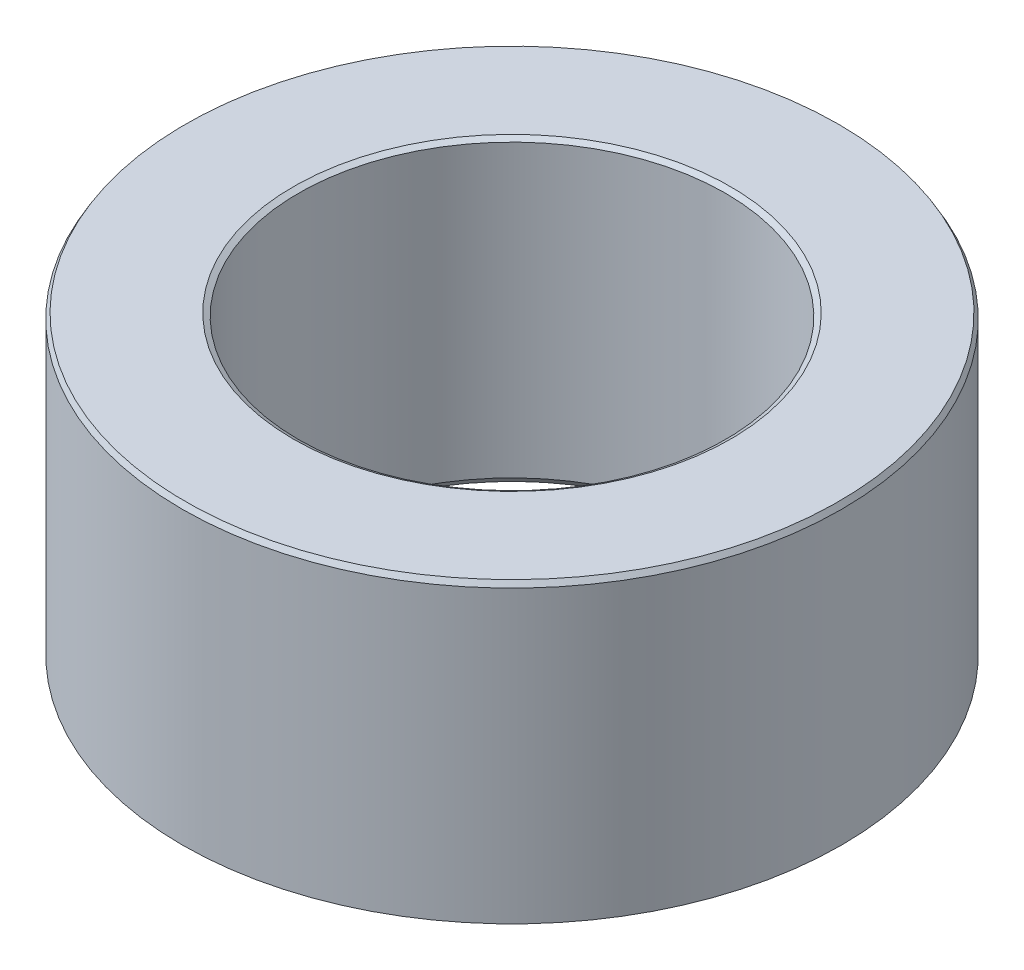
from build123d import *
from OCP.BRepFilletAPI import BRepFilletAPI_MakeChamfer

# Parameters (mm, degrees)
SKETCH1_R           = 45
BOSS_EXTRUDE1_DEPTH = 40.814567303
SKETCH2_R           = 29.131655499
CUT_EXTRUDE1_DEPTH  = 76.603101154
CHAMFER1_SIZE       = 0.712806596
CHAMFER1_SIZE2      = 0.41153908


with BuildPart() as part:
    # Sketch1 → Boss-Extrude1 (new body)
    with BuildSketch(Plane(origin=(0, 0, 0), x_dir=(1, 0, 0), z_dir=(0, 1, 0))):
        Circle(SKETCH1_R)
    extrude(amount=BOSS_EXTRUDE1_DEPTH)

    # Sketch2 → Cut-Extrude1 (cut, through all)
    with BuildSketch(Plane(origin=(0, 0, 0), x_dir=(1, 0, 0), z_dir=(0, 1, 0))):
        Circle(SKETCH2_R)
    extrude(amount=CUT_EXTRUDE1_DEPTH, mode=Mode.SUBTRACT)

    # Chamfer1: one chamfer whose edges measure the first distance from different faces: ONE call of the kernel's chamfer builder (chamfer() names one face for all edges)
    chamfer1_edges_1 = [part.edges().sort_by_distance(p)[0] for p in [
        (-29.131655499, 40.814567303, 0),
    ]]
    chamfer1_side_1 = [part.faces().sort_by_distance(p)[0] for p in [
        (-43.727207794, 40.814567303, 0),
    ]]
    chamfer1_edges_2 = [part.edges().sort_by_distance(p)[0] for p in [
        (-29.131655499, 0, 0),
    ]]
    chamfer1_side_2 = [part.faces().sort_by_distance(p)[0] for p in [
        (-29.131655499, 20.407283651, 0),
    ]]
    chamfer1_edges_3 = [part.edges().sort_by_distance(p)[0] for p in [
        (-45, 0, 0),
    ]]
    chamfer1_side_3 = [part.faces().sort_by_distance(p)[0] for p in [
        (-43.727207794, 0, 0),
    ]]
    chamfer1_edges_4 = [part.edges().sort_by_distance(p)[0] for p in [
        (-45, 40.814567303, 0),
    ]]
    chamfer1_side_4 = [part.faces().sort_by_distance(p)[0] for p in [
        (-45, 20.407283651, 0),
    ]]
    chamfer1 = BRepFilletAPI_MakeChamfer(part.part.solid().wrapped)
    for e in chamfer1_edges_1:
        chamfer1.Add(CHAMFER1_SIZE, CHAMFER1_SIZE2, e.wrapped, chamfer1_side_1[0].wrapped)  # the first distance lies on this face
    for e in chamfer1_edges_2:
        chamfer1.Add(CHAMFER1_SIZE, CHAMFER1_SIZE2, e.wrapped, chamfer1_side_2[0].wrapped)  # the first distance lies on this face
    for e in chamfer1_edges_3:
        chamfer1.Add(CHAMFER1_SIZE, CHAMFER1_SIZE2, e.wrapped, chamfer1_side_3[0].wrapped)  # the first distance lies on this face
    for e in chamfer1_edges_4:
        chamfer1.Add(CHAMFER1_SIZE, CHAMFER1_SIZE2, e.wrapped, chamfer1_side_4[0].wrapped)  # the first distance lies on this face
    add(Compound.cast(chamfer1.Shape()), mode=Mode.REPLACE)


solid = part.part
